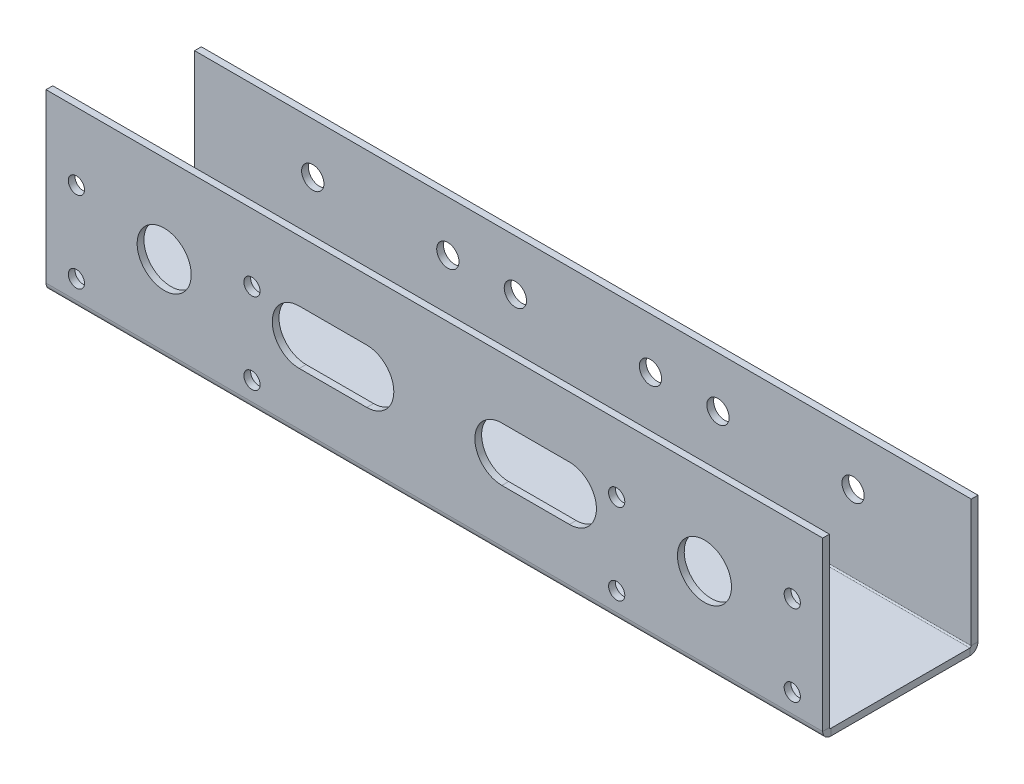
from build123d import *

# Parameters (mm, degrees)
BASIS_BLECH1_DEPTH              = 57.5
SCHNITT_LINEAR_AUSTRAGEN1_REACH = 68.785
SKIZZE6_R                       = 4
SKIZZE6_R_2                     = 1.2
SCHNITT_LINEAR_AUSTRAGEN2_REACH = 68.785
SKIZZE7_R                       = 1.65


# Sheet-metal steps are written as plain solids
with BuildPart() as part:
    # Skizze1 → Basis-Blech1 (new, symmetric)
    with BuildSketch(Plane(origin=(0, 0, 0), x_dir=(0, 0, -1), z_dir=(1, 0, 0))):
        with BuildLine():
            Line((-10.5, 25), (-10.5, 0.2))
            ThreePointArc((-10.5, 0.2), (-10.441421356, 0.058578644), (-10.3, 0))
            Line((-10.3, 0), (10.3, 0))
            ThreePointArc((10.3, 0), (10.441421356, 0.058578644), (10.5, 0.2))
            Line((10.5, 0.2), (10.5, 19))
            Line((10.5, 19), (11.5, 19))
            Line((11.5, 19), (11.5, 0.2))
            ThreePointArc((11.5, 0.2), (11.148528137, -0.648528137), (10.3, -1))
            Line((10.3, -1), (-10.3, -1))
            ThreePointArc((-10.3, -1), (-11.148528137, -0.648528137), (-11.5, 0.2))
            Line((-11.5, 0.2), (-11.5, 25))
            Line((-11.5, 25), (-10.5, 25))
        make_face()
    extrude(amount=BASIS_BLECH1_DEPTH, both=True)

    # Skizze6 → Schnitt-Linear austragen1 (cut, up to next)
    with BuildSketch(Plane.XY.offset(11.5), mode=Mode.PRIVATE) as schnitt_linear_austragen1_sk1:
        with Locations((-40, 12)):
            Circle(SKIZZE6_R)
    schnitt_linear_austragen1_tool1 = extrude(schnitt_linear_austragen1_sk1.sketch, amount=-SCHNITT_LINEAR_AUSTRAGEN1_REACH, mode=Mode.PRIVATE) & part.part
    # Skizze6 → Schnitt-Linear austragen1 (cut, up to next)
    with BuildSketch(Plane.XY.offset(11.5), mode=Mode.PRIVATE) as schnitt_linear_austragen1_sk2:
        with Locations((-53, 15)):
            Circle(SKIZZE6_R_2)
    schnitt_linear_austragen1_tool2 = extrude(schnitt_linear_austragen1_sk2.sketch, amount=-SCHNITT_LINEAR_AUSTRAGEN1_REACH, mode=Mode.PRIVATE) & part.part
    # Skizze6 → Schnitt-Linear austragen1 (cut, up to next)
    with BuildSketch(Plane.XY.offset(11.5), mode=Mode.PRIVATE) as schnitt_linear_austragen1_sk3:
        with Locations((-53, 3)):
            Circle(SKIZZE6_R_2)
    schnitt_linear_austragen1_tool3 = extrude(schnitt_linear_austragen1_sk3.sketch, amount=-SCHNITT_LINEAR_AUSTRAGEN1_REACH, mode=Mode.PRIVATE) & part.part
    # Skizze6 → Schnitt-Linear austragen1 (cut, up to next)
    with BuildSketch(Plane.XY.offset(11.5), mode=Mode.PRIVATE) as schnitt_linear_austragen1_sk4:
        with Locations((-27, 15)):
            Circle(SKIZZE6_R_2)
    schnitt_linear_austragen1_tool4 = extrude(schnitt_linear_austragen1_sk4.sketch, amount=-SCHNITT_LINEAR_AUSTRAGEN1_REACH, mode=Mode.PRIVATE) & part.part
    # Skizze6 → Schnitt-Linear austragen1 (cut, up to next)
    with BuildSketch(Plane.XY.offset(11.5), mode=Mode.PRIVATE) as schnitt_linear_austragen1_sk5:
        with Locations((-27, 3)):
            Circle(SKIZZE6_R_2)
    schnitt_linear_austragen1_tool5 = extrude(schnitt_linear_austragen1_sk5.sketch, amount=-SCHNITT_LINEAR_AUSTRAGEN1_REACH, mode=Mode.PRIVATE) & part.part
    # Skizze6 → Schnitt-Linear austragen1 (cut, up to next)
    with BuildSketch(Plane.XY.offset(11.5), mode=Mode.PRIVATE) as schnitt_linear_austragen1_sk6:
        with Locations(Location((53, 3, 0), (0, 0, 90))):
            Circle(SKIZZE6_R_2)
    schnitt_linear_austragen1_tool6 = extrude(schnitt_linear_austragen1_sk6.sketch, amount=-SCHNITT_LINEAR_AUSTRAGEN1_REACH, mode=Mode.PRIVATE) & part.part
    # Skizze6 → Schnitt-Linear austragen1 (cut, up to next)
    with BuildSketch(Plane.XY.offset(11.5), mode=Mode.PRIVATE) as schnitt_linear_austragen1_sk7:
        with Locations(Location((27, 3, 0), (0, 0, 90))):
            Circle(SKIZZE6_R_2)
    schnitt_linear_austragen1_tool7 = extrude(schnitt_linear_austragen1_sk7.sketch, amount=-SCHNITT_LINEAR_AUSTRAGEN1_REACH, mode=Mode.PRIVATE) & part.part
    # Skizze6 → Schnitt-Linear austragen1 (cut, up to next)
    with BuildSketch(Plane.XY.offset(11.5), mode=Mode.PRIVATE) as schnitt_linear_austragen1_sk8:
        with Locations(Location((27, 15, 0), (0, 0, 90))):
            Circle(SKIZZE6_R_2)
    schnitt_linear_austragen1_tool8 = extrude(schnitt_linear_austragen1_sk8.sketch, amount=-SCHNITT_LINEAR_AUSTRAGEN1_REACH, mode=Mode.PRIVATE) & part.part
    # Skizze6 → Schnitt-Linear austragen1 (cut, up to next)
    with BuildSketch(Plane.XY.offset(11.5), mode=Mode.PRIVATE) as schnitt_linear_austragen1_sk9:
        with Locations(Location((40, 12, 0), (0, 0, 90))):
            Circle(SKIZZE6_R)
    schnitt_linear_austragen1_tool9 = extrude(schnitt_linear_austragen1_sk9.sketch, amount=-SCHNITT_LINEAR_AUSTRAGEN1_REACH, mode=Mode.PRIVATE) & part.part
    # Skizze6 → Schnitt-Linear austragen1 (cut, up to next)
    with BuildSketch(Plane.XY.offset(11.5), mode=Mode.PRIVATE) as schnitt_linear_austragen1_sk10:
        with Locations(Location((53, 15, 0), (0, 0, 90))):
            Circle(SKIZZE6_R_2)
    schnitt_linear_austragen1_tool10 = extrude(schnitt_linear_austragen1_sk10.sketch, amount=-SCHNITT_LINEAR_AUSTRAGEN1_REACH, mode=Mode.PRIVATE) & part.part
    # Skizze6 → Schnitt-Linear austragen1 (cut, up to next)
    with BuildSketch(Plane.XY.offset(11.5), mode=Mode.PRIVATE) as schnitt_linear_austragen1_sk11:
        with BuildLine():
            Line((-20, 16), (-10, 16))
            ThreePointArc((-10, 16), (-6, 12), (-10, 8))
            Line((-10, 8), (-20, 8))
            ThreePointArc((-20, 8), (-24, 12), (-20, 16))
        make_face()
    schnitt_linear_austragen1_tool11 = extrude(schnitt_linear_austragen1_sk11.sketch, amount=-SCHNITT_LINEAR_AUSTRAGEN1_REACH, mode=Mode.PRIVATE) & part.part
    # Skizze6 → Schnitt-Linear austragen1 (cut, up to next)
    with BuildSketch(Plane.XY.offset(11.5), mode=Mode.PRIVATE) as schnitt_linear_austragen1_sk12:
        with BuildLine():
            Line((20, 16), (10, 16))
            ThreePointArc((10, 16), (6, 12), (10, 8))
            Line((10, 8), (20, 8))
            ThreePointArc((20, 8), (24, 12), (20, 16))
        make_face()
    schnitt_linear_austragen1_tool12 = extrude(schnitt_linear_austragen1_sk12.sketch, amount=-SCHNITT_LINEAR_AUSTRAGEN1_REACH, mode=Mode.PRIVATE) & part.part
    add(schnitt_linear_austragen1_tool1.solids().sort_by_distance((-40, 12, 11.5))[0], mode=Mode.SUBTRACT)
    add(schnitt_linear_austragen1_tool2.solids().sort_by_distance((-53, 15, 11.5))[0], mode=Mode.SUBTRACT)
    add(schnitt_linear_austragen1_tool3.solids().sort_by_distance((-53, 3, 11.5))[0], mode=Mode.SUBTRACT)
    add(schnitt_linear_austragen1_tool4.solids().sort_by_distance((-27, 15, 11.5))[0], mode=Mode.SUBTRACT)
    add(schnitt_linear_austragen1_tool5.solids().sort_by_distance((-27, 3, 11.5))[0], mode=Mode.SUBTRACT)
    add(schnitt_linear_austragen1_tool6.solids().sort_by_distance((53, 3, 11.5))[0], mode=Mode.SUBTRACT)
    add(schnitt_linear_austragen1_tool7.solids().sort_by_distance((27, 3, 11.5))[0], mode=Mode.SUBTRACT)
    add(schnitt_linear_austragen1_tool8.solids().sort_by_distance((27, 15, 11.5))[0], mode=Mode.SUBTRACT)
    add(schnitt_linear_austragen1_tool9.solids().sort_by_distance((40, 12, 11.5))[0], mode=Mode.SUBTRACT)
    add(schnitt_linear_austragen1_tool10.solids().sort_by_distance((53, 15, 11.5))[0], mode=Mode.SUBTRACT)
    add(schnitt_linear_austragen1_tool11.solids().sort_by_distance((-15, 12, 11.5))[0], mode=Mode.SUBTRACT)
    add(schnitt_linear_austragen1_tool12.solids().sort_by_distance((15, 12, 11.5))[0], mode=Mode.SUBTRACT)

    # Skizze7 → Schnitt-Linear austragen2 (cut, up to next)
    with BuildSketch(Plane(origin=(0, 0, -11.5), x_dir=(-1, 0, 0), z_dir=(0, 0, -1)), mode=Mode.PRIVATE) as schnitt_linear_austragen2_sk1:
        with Locations(Location((-40, 11.5, 0), (0, 0, 90))):
            Circle(SKIZZE7_R)
    schnitt_linear_austragen2_tool1 = extrude(schnitt_linear_austragen2_sk1.sketch, amount=-SCHNITT_LINEAR_AUSTRAGEN2_REACH, mode=Mode.PRIVATE) & part.part
    # Skizze7 → Schnitt-Linear austragen2 (cut, up to next)
    with BuildSketch(Plane(origin=(0, 0, -11.5), x_dir=(-1, 0, 0), z_dir=(0, 0, -1)), mode=Mode.PRIVATE) as schnitt_linear_austragen2_sk2:
        with Locations(Location((-20, 11.5, 0), (0, 0, 90))):
            Circle(SKIZZE7_R)
    schnitt_linear_austragen2_tool2 = extrude(schnitt_linear_austragen2_sk2.sketch, amount=-SCHNITT_LINEAR_AUSTRAGEN2_REACH, mode=Mode.PRIVATE) & part.part
    # Skizze7 → Schnitt-Linear austragen2 (cut, up to next)
    with BuildSketch(Plane(origin=(0, 0, -11.5), x_dir=(-1, 0, 0), z_dir=(0, 0, -1)), mode=Mode.PRIVATE) as schnitt_linear_austragen2_sk3:
        with Locations(Location((-10, 11.5, 0), (0, 0, 90))):
            Circle(SKIZZE7_R)
    schnitt_linear_austragen2_tool3 = extrude(schnitt_linear_austragen2_sk3.sketch, amount=-SCHNITT_LINEAR_AUSTRAGEN2_REACH, mode=Mode.PRIVATE) & part.part
    # Skizze7 → Schnitt-Linear austragen2 (cut, up to next)
    with BuildSketch(Plane(origin=(0, 0, -11.5), x_dir=(-1, 0, 0), z_dir=(0, 0, -1)), mode=Mode.PRIVATE) as schnitt_linear_austragen2_sk4:
        with Locations(Location((10, 11.5, 0), (0, 0, 90))):
            Circle(SKIZZE7_R)
    schnitt_linear_austragen2_tool4 = extrude(schnitt_linear_austragen2_sk4.sketch, amount=-SCHNITT_LINEAR_AUSTRAGEN2_REACH, mode=Mode.PRIVATE) & part.part
    # Skizze7 → Schnitt-Linear austragen2 (cut, up to next)
    with BuildSketch(Plane(origin=(0, 0, -11.5), x_dir=(-1, 0, 0), z_dir=(0, 0, -1)), mode=Mode.PRIVATE) as schnitt_linear_austragen2_sk5:
        with Locations(Location((20, 11.5, 0), (0, 0, 90))):
            Circle(SKIZZE7_R)
    schnitt_linear_austragen2_tool5 = extrude(schnitt_linear_austragen2_sk5.sketch, amount=-SCHNITT_LINEAR_AUSTRAGEN2_REACH, mode=Mode.PRIVATE) & part.part
    # Skizze7 → Schnitt-Linear austragen2 (cut, up to next)
    with BuildSketch(Plane(origin=(0, 0, -11.5), x_dir=(-1, 0, 0), z_dir=(0, 0, -1)), mode=Mode.PRIVATE) as schnitt_linear_austragen2_sk6:
        with Locations(Location((40, 11.5, 0), (0, 0, 90))):
            Circle(SKIZZE7_R)
    schnitt_linear_austragen2_tool6 = extrude(schnitt_linear_austragen2_sk6.sketch, amount=-SCHNITT_LINEAR_AUSTRAGEN2_REACH, mode=Mode.PRIVATE) & part.part
    add(schnitt_linear_austragen2_tool1.solids().sort_by_distance((40, 11.5, -11.5))[0], mode=Mode.SUBTRACT)
    add(schnitt_linear_austragen2_tool2.solids().sort_by_distance((20, 11.5, -11.5))[0], mode=Mode.SUBTRACT)
    add(schnitt_linear_austragen2_tool3.solids().sort_by_distance((10, 11.5, -11.5))[0], mode=Mode.SUBTRACT)
    add(schnitt_linear_austragen2_tool4.solids().sort_by_distance((-10, 11.5, -11.5))[0], mode=Mode.SUBTRACT)
    add(schnitt_linear_austragen2_tool5.solids().sort_by_distance((-20, 11.5, -11.5))[0], mode=Mode.SUBTRACT)
    add(schnitt_linear_austragen2_tool6.solids().sort_by_distance((-40, 11.5, -11.5))[0], mode=Mode.SUBTRACT)


solid = part.part
